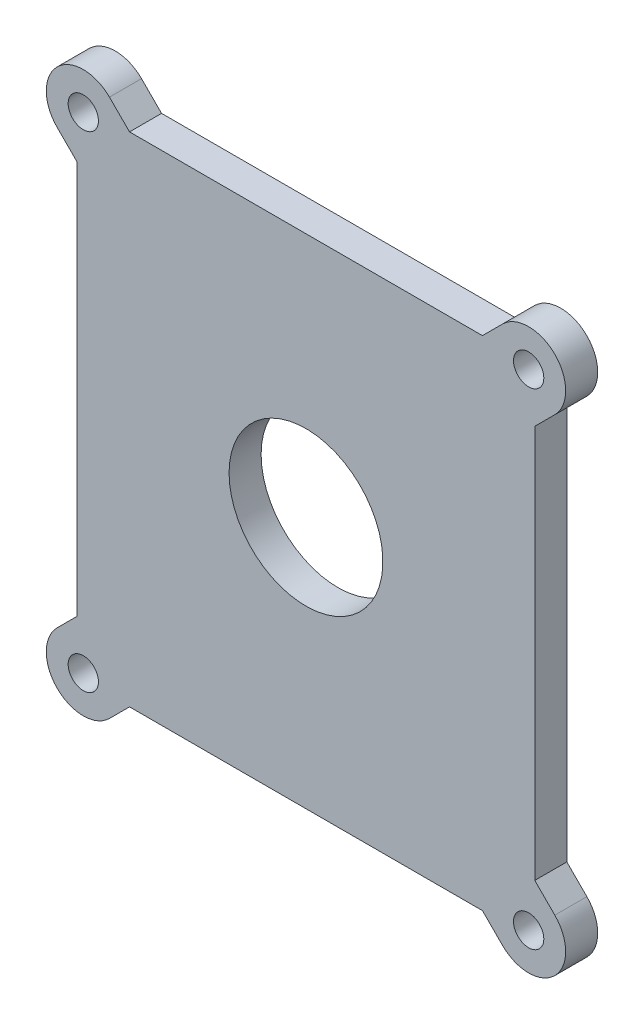
from build123d import *

# Parameters (mm, degrees)
SKETCH4_R            = 11.43
BOSS_EXTRUDE1_DEPTH  = 4.7625
M4_CLEARANCE_HOLE2_D = 4.5


with BuildPart() as part:
    # Sketch4 → Boss-Extrude1 (new body)
    with BuildSketch(Plane.XY.offset(-16.108276911)):
        with BuildLine():
            Line((25.950280313, 36.9951), (-26.4933705, 36.9951))
            Line((-26.4933705, 36.9951), (-29.473828047, 39.975557546))
            ThreePointArc((-29.473828047, 39.975557546), (-37.25200264, 39.975557546), (-37.25200264, 32.197382953))
            Line((-37.25200264, 32.197382953), (-34.271545094, 29.216925407))
            Line((-34.271545094, 29.216925407), (-34.271545094, -29.226725407))
            Line((-34.271545094, -29.226725407), (-37.25200264, -32.207182953))
            ThreePointArc((-37.25200264, -32.207182953), (-37.25200264, -39.985357546), (-29.473828047, -39.985357546))
            Line((-29.473828047, -39.985357546), (-26.4933705, -37.0049))
            Line((-26.4933705, -37.0049), (25.950280313, -37.0049))
            Line((25.950280313, -37.0049), (28.93073786, -39.985357546))
            ThreePointArc((28.93073786, -39.985357546), (36.708912453, -39.985357546), (36.708912453, -32.207182953))
            Line((36.708912453, -32.207182953), (33.728454906, -29.226725407))
            Line((33.728454906, -29.226725407), (33.728454906, 29.216925407))
            Line((33.728454906, 29.216925407), (36.708912453, 32.197382953))
            ThreePointArc((36.708912453, 32.197382953), (36.708912453, 39.975557546), (28.93073786, 39.975557546))
            Line((28.93073786, 39.975557546), (25.950280313, 36.9951))
        make_face()
        with Locations((-0.271545094, 0.4951)):
            Circle(SKETCH4_R, mode=Mode.SUBTRACT)
    extrude(amount=BOSS_EXTRUDE1_DEPTH)

    # M4 Clearance Hole2 (through all)
    with Locations(Plane.XY.offset(-11.345776911)):
        with Locations((-33.362915343, 36.08647025), (32.819825156, 36.08647025), (32.819825156, -36.09627025), (-33.362915343, -36.09627025)):
            Hole(M4_CLEARANCE_HOLE2_D / 2)


solid = part.part
